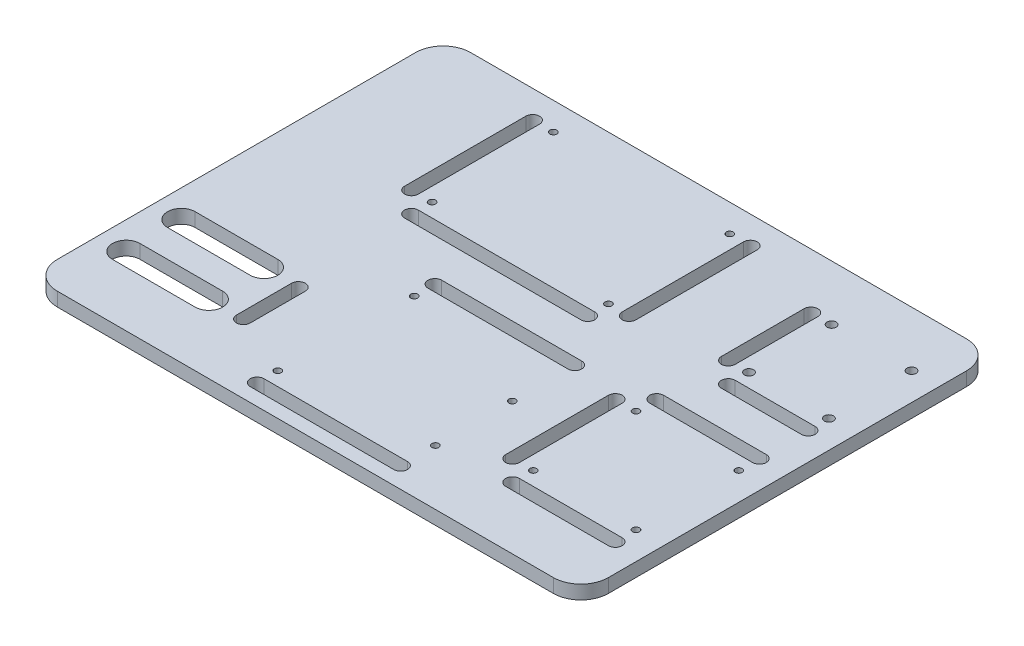
from build123d import *

# Parameters (mm, degrees)
BOSS_EXTRUDE1_DEPTH          = 5
ARDUINO_UNO_HOLES_D          = 2.5
L298N_HOLES_D                = 2.5
PROTOBOARD_HOLES_D           = 2.5
L_BRACKET_HOLES_D            = 3.3
POWER_BLOCK_SLOTS_DEPTH      = 126.099960032
CABLE_MANAGEMENT_SLOTS_DEPTH = 126.099960032


with BuildPart() as part:
    # Sketch1 → Boss-Extrude1 (new body)
    with BuildSketch(Plane(origin=(0, 0, 0), x_dir=(1, 0, 0), z_dir=(0, 1, 0))):
        with BuildLine():
            Line((-90, -75), (90, -75))
            ThreePointArc((90, -75), (97.071067812, -72.071067812), (100, -65))
            Line((100, -65), (100, 65))
            ThreePointArc((100, 65), (97.071067812, 72.071067812), (90, 75))
            Line((90, 75), (-90, 75))
            ThreePointArc((-90, 75), (-97.071067812, 72.071067812), (-100, 65))
            Line((-100, 65), (-100, -65))
            ThreePointArc((-100, -65), (-97.071067812, -72.071067812), (-90, -75))
        make_face()
    extrude(amount=BOSS_EXTRUDE1_DEPTH)

    # arduino uno holes (through all)
    with Locations(Plane(origin=(0, 5, 0), x_dir=(1, 0, 0), z_dir=(0, 1, 0))):
        with Locations((27.1, -27), (27.1, -54.9), (-23.7, -11.8), (-25, -60)):
            Hole(ARDUINO_UNO_HOLES_D / 2)

    # l298n holes (through all)
    with Locations(Plane(origin=(0, 5, 0), x_dir=(1, 0, 0), z_dir=(0, 1, 0))):
        with Locations((52.7, -45), (90, -45), (90, -7.7), (52.7, -7.7)):
            Hole(L298N_HOLES_D / 2)

    # protoboard holes (through all)
    with Locations(Plane(origin=(0, 5, 0), x_dir=(1, 0, 0), z_dir=(0, 1, 0))):
        with Locations((-50, 21), (14, 21), (14, 65), (-50, 65)):
            Hole(PROTOBOARD_HOLES_D / 2)

    # l-bracket holes (through all)
    with Locations(Plane(origin=(0, 5, 0), x_dir=(1, 0, 0), z_dir=(0, 1, 0))):
        with Locations((61, 55), (90, 55), (90, 25), (61, 25)):
            Hole(L_BRACKET_HOLES_D / 2)

    # Sketch24 → power block slots (cut, through all)
    with BuildSketch(Plane(origin=(0, 5, 0), x_dir=(1, 0, 0), z_dir=(0, 1, 0))):
        with BuildLine():
            Line((-60, -35), (-90, -35))
            ThreePointArc((-90, -35), (-95, -30), (-90, -25))
            Line((-90, -25), (-60, -25))
            ThreePointArc((-60, -25), (-55, -30), (-60, -35))
        make_face()
        with BuildLine():
            Line((-60, -45), (-90, -45))
            ThreePointArc((-90, -45), (-95, -50), (-90, -55))
            Line((-90, -55), (-60, -55))
            ThreePointArc((-60, -55), (-55, -50), (-60, -45))
        make_face()
    extrude(amount=-POWER_BLOCK_SLOTS_DEPTH, mode=Mode.SUBTRACT)

    # Sketch26 → cable management slots (cut, through all)
    with BuildSketch(Plane(origin=(0, 5, 0), x_dir=(1, 0, 0), z_dir=(0, 1, 0))):
        with BuildLine():
            Line((-50, 16), (14, 16))
            ThreePointArc((14, 16), (16.5, 13.5), (14, 11))
            Line((14, 11), (-50, 11))
            ThreePointArc((-50, 11), (-52.5, 13.5), (-50, 16))
        make_face()
        with BuildLine():
            Line((24, 65), (24, 21))
            ThreePointArc((24, 21), (21.5, 18.5), (19, 21))
            Line((19, 21), (19, 65))
            ThreePointArc((19, 65), (21.5, 67.5), (24, 65))
        make_face()
        with BuildLine():
            Line((56, 55), (56, 25))
            ThreePointArc((56, 25), (53.5, 22.5), (51, 25))
            Line((51, 25), (51, 55))
            ThreePointArc((51, 55), (53.5, 57.5), (56, 55))
        make_face()
        with BuildLine():
            Line((61, 20), (90, 20))
            ThreePointArc((90, 20), (92.5, 17.5), (90, 15))
            Line((90, 15), (61, 15))
            ThreePointArc((61, 15), (58.5, 17.5), (61, 20))
        make_face()
        with BuildLine():
            Line((52.7, 2.3), (90, 2.3))
            ThreePointArc((90, 2.3), (92.5, -0.2), (90, -2.7))
            Line((90, -2.7), (52.7, -2.7))
            ThreePointArc((52.7, -2.7), (50.2, -0.2), (52.7, 2.3))
        make_face()
        with BuildLine():
            Line((47.7, -7.7), (47.7, -45))
            ThreePointArc((47.7, -45), (45.2, -47.5), (42.7, -45))
            Line((42.7, -45), (42.7, -7.7))
            ThreePointArc((42.7, -7.7), (45.2, -5.2), (47.7, -7.7))
        make_face()
        with BuildLine():
            Line((-25, -65), (27.1, -65))
            ThreePointArc((27.1, -65), (29.6, -67.5), (27.1, -70))
            Line((27.1, -70), (-25, -70))
            ThreePointArc((-25, -70), (-27.5, -67.5), (-25, -65))
        make_face()
        with BuildLine():
            Line((-45, -30), (-45, -50))
            ThreePointArc((-45, -50), (-47.5, -52.5), (-50, -50))
            Line((-50, -50), (-50, -30))
            ThreePointArc((-50, -30), (-47.5, -27.5), (-45, -30))
        make_face()
        with BuildLine():
            Line((-23.7, -1.8), (27.1, -1.8))
            ThreePointArc((27.1, -1.8), (29.6, -4.3), (27.1, -6.8))
            Line((27.1, -6.8), (-23.7, -6.8))
            ThreePointArc((-23.7, -6.8), (-26.2, -4.3), (-23.7, -1.8))
        make_face()
        with BuildLine():
            Line((-55, 65), (-55, 21))
            ThreePointArc((-55, 21), (-57.5, 18.5), (-60, 21))
            Line((-60, 21), (-60, 65))
            ThreePointArc((-60, 65), (-57.5, 67.5), (-55, 65))
        make_face()
        with BuildLine():
            Line((90, -55), (52.7, -55))
            ThreePointArc((52.7, -55), (50.2, -52.5), (52.7, -50))
            Line((52.7, -50), (90, -50))
            ThreePointArc((90, -50), (92.5, -52.5), (90, -55))
        make_face()
    extrude(amount=-CABLE_MANAGEMENT_SLOTS_DEPTH, mode=Mode.SUBTRACT)


solid = part.part
